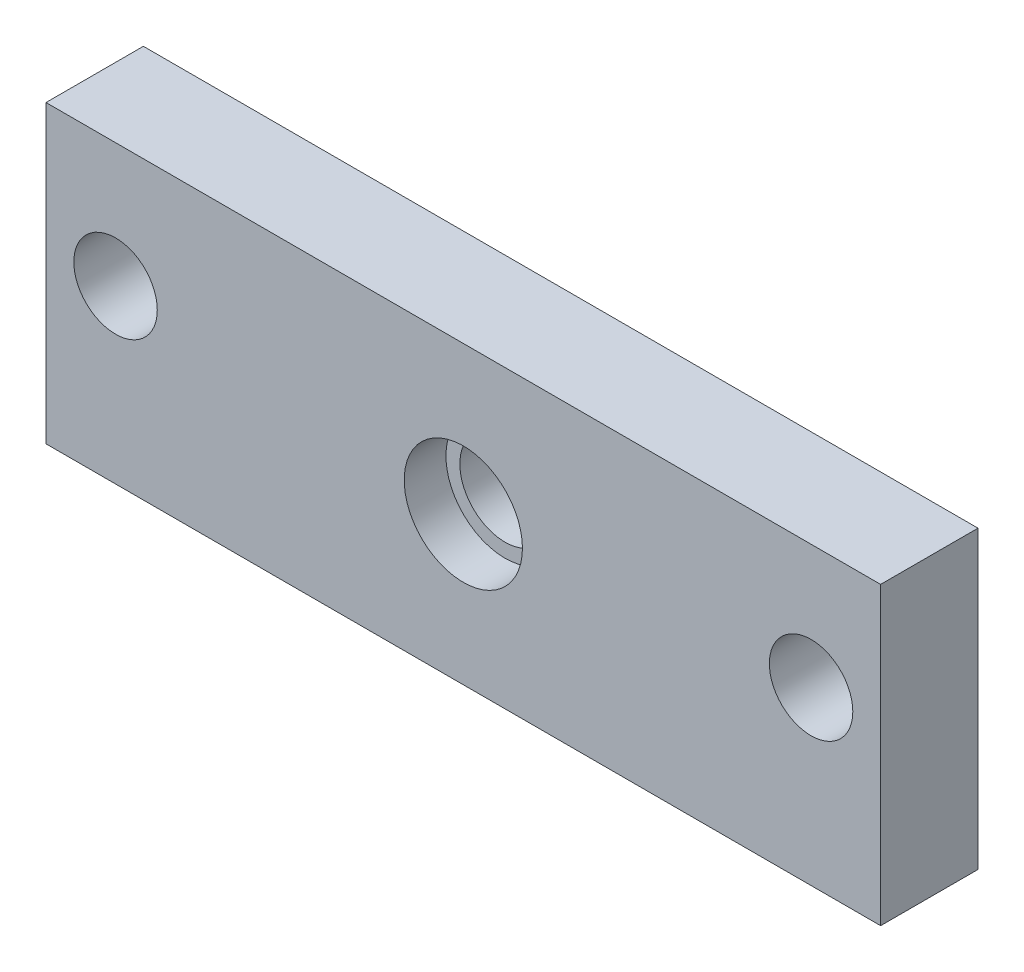
from build123d import *

# Parameters (mm, degrees)
SKETCH1_W           = 120
SKETCH1_H           = 42.5
BOSS_EXTRUDE1_DEPTH = 7
SKETCH2_R           = 8.5
CUT_EXTRUDE1_DEPTH  = 6
SKETCH3_R           = 6.5
CUT_EXTRUDE2_DEPTH  = 65.152649984
SKETCH5_R           = 6
CUT_EXTRUDE4_DEPTH  = 66.173326599
SKETCH6_R           = 2.5
SKETCH6_R_2         = 1.25
CUT_EXTRUDE5_DEPTH  = 10


with BuildPart() as part:
    # Sketch1 → Boss-Extrude1 (new, symmetric)
    with BuildSketch(Plane.XY):
        Rectangle(SKETCH1_W, SKETCH1_H)
    extrude(amount=BOSS_EXTRUDE1_DEPTH, both=True)

    # Sketch2 → Cut-Extrude1 (cut)
    with BuildSketch(Plane.XY.offset(7)):
        Circle(SKETCH2_R)
    extrude(amount=-CUT_EXTRUDE1_DEPTH, mode=Mode.SUBTRACT)

    # Sketch3 → Cut-Extrude2 (cut, through all)
    with BuildSketch(Plane.XY.offset(1)):
        Circle(SKETCH3_R)
    extrude(amount=-CUT_EXTRUDE2_DEPTH, mode=Mode.SUBTRACT)

    # Sketch5 → Cut-Extrude4 (cut, through all)
    with BuildSketch(Plane.XY.offset(7)):
        with Locations((-50, 3.4)):
            Circle(SKETCH5_R)
        with Locations((50, 3.4)):
            Circle(SKETCH5_R)
    extrude(amount=-CUT_EXTRUDE4_DEPTH, mode=Mode.SUBTRACT)

    # Sketch6 → Cut-Extrude5 (cut)
    with BuildSketch(Plane.XZ.offset(21.25)):
        with Locations((-50, 0)):
            Circle(SKETCH6_R)
        with Locations((-25, 0)):
            Circle(SKETCH6_R)
        with Locations((25, 0)):
            Circle(SKETCH6_R)
        with Locations((50, 0)):
            Circle(SKETCH6_R)
        with Locations((-37.5, 0)):
            Circle(SKETCH6_R_2)
        with Locations((37.5, 0)):
            Circle(SKETCH6_R_2)
    extrude(amount=-CUT_EXTRUDE5_DEPTH, mode=Mode.SUBTRACT)


solid = part.part
